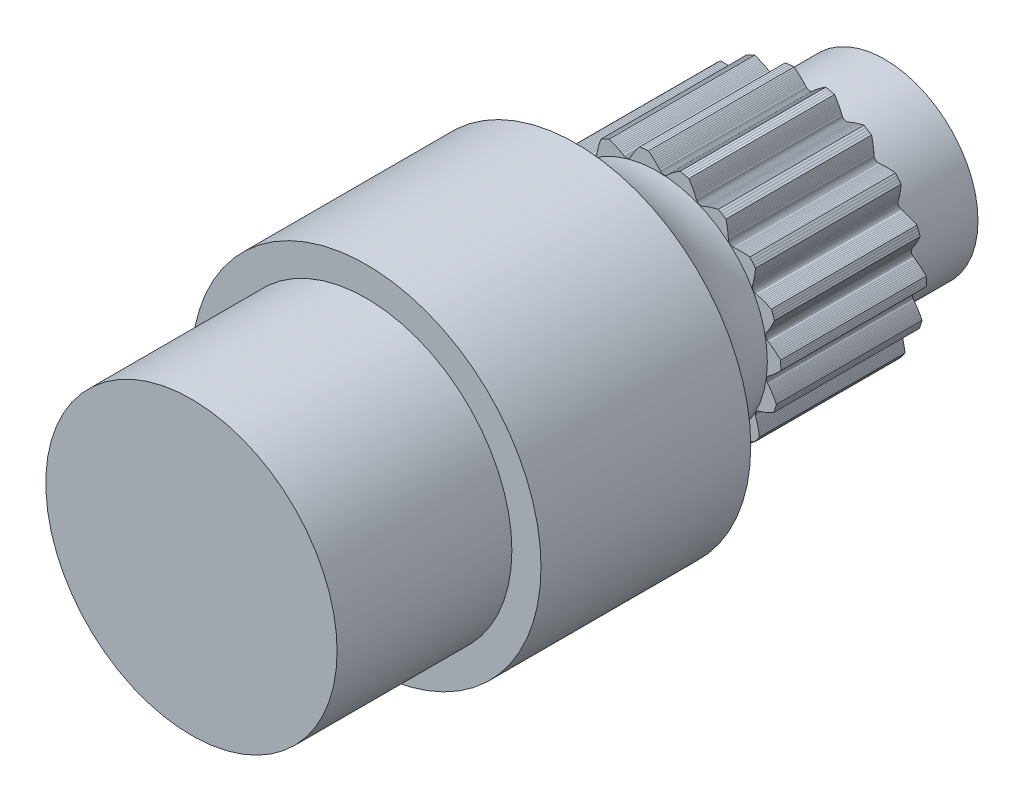
from build123d import *

# Parameters (mm, degrees)
BOSS_EXTRUDE1_DEPTH      = 6
BOSS_EXTRUDE1_DEPTH_BACK = 6.5


with BuildPart() as part:
    # 19T Shaft → Boss-Extrude1 (new, two sides: drawn at the far end of the back side and taken through both)
    with BuildSketch(Plane.XY.offset(-BOSS_EXTRUDE1_DEPTH_BACK)):
        Polygon((6.023106356, -8.692720522), (5.86435407, -8.800599502), (5.703670084, -8.90557959), (5.574457194, -8.88263519), (5.447639445, -8.857900166), (5.323239894, -8.831448754), (5.198405862, -8.802667164), (5.076149615, -8.772244747), (4.956489957, -8.740261879), (4.836752896, -8.706003916), (4.719768004, -8.670282776), (4.602985258, -8.632326454), (4.489107653, -8.593022605), (4.327362162, -8.533132654), (4.290916776, -8.521301114), (4.254021844, -8.513594141), (4.215833329, -8.509876971), (4.177758776, -8.510371404), (4.140158745, -8.515007457), (4.103409314, -8.523695892), (4.067890602, -8.536320589), (4.053138471, -8.54290106), (4.042867825, -8.547766359), (4.032591339, -8.552619311), (4.022309028, -8.557459908), (4.012020905, -8.562288143), (3.997558248, -8.569482551), (3.965220019, -8.588852651), (3.935135554, -8.611676643), (3.907636288, -8.637735147), (3.883030341, -8.666794799), (3.861601106, -8.698621956), (3.844073002, -8.731989591), (3.830012988, -8.767634612), (3.773308927, -8.930524327), (3.731178233, -9.04338666), (3.686159572, -9.157632939), (3.63928787, -9.270613062), (3.589536303, -9.384785534), (3.538078764, -9.497450788), (3.483765299, -9.611126472), (3.426545863, -9.725746938), (3.367805145, -9.838549658), (3.306201696, -9.952125968), (3.241692914, -10.066410845), (3.058468233, -10.123584954), (2.874236101, -10.177424384), (2.689057204, -10.2279114), (2.50299254, -10.275029372), (2.388230796, -10.211372806), (2.276315831, -10.146800338), (2.167245351, -10.081389669), (2.058520538, -10.013634001), (1.952766614, -9.945163416), (1.849975267, -9.87606004), (1.747849432, -9.804779708), (1.64880174, -9.733009106), (1.550671003, -9.659190066), (1.455725539, -9.585039811), (1.3221901, -9.475876187), (1.291561121, -9.452851915), (1.259167708, -9.433582762), (1.224255315, -9.417667208), (1.188083204, -9.405772064), (1.151015123, -9.397948213), (1.113435747, -9.394233364), (1.075742305, -9.394641113), (1.05965281, -9.396075027), (1.048358895, -9.397341838), (1.037063467, -9.398595073), (1.02576654, -9.399834732), (1.014468131, -9.401060812), (0.99845308, -9.403169391), (0.961577565, -9.410989759), (0.925712221, -9.422808675), (0.891241758, -9.43852626), (0.858533375, -9.458021842), (0.827930974, -9.481166455), (0.800518138, -9.507034773), (0.775646016, -9.536183169), (0.669124132, -9.671835292), (0.592629856, -9.764902619), (0.512954724, -9.858341183), (0.431938074, -9.949980515), (0.347810443, -10.0418125), (0.262558668, -10.131665005), (0.174277622, -10.221545872), (0.082941288, -10.311376766), (-0.009243679, -10.398994443), (-0.104387451, -10.486414267), (-0.202509208, -10.573560908), (-0.394370673, -10.568144209), (-0.586102234, -10.559246395), (-0.777640735, -10.546870395), (-0.968923083, -10.531020288), (-1.056797466, -10.433549734), (-1.141681923, -10.33613725), (-1.223603855, -10.238855584), (-1.304437427, -10.139468216), (-1.382228949, -10.040369314), (-1.457012949, -9.941633853), (-1.530460638, -9.841055481), (-1.600837777, -9.741012876), (-1.669682517, -9.639330557), (-1.735407025, -9.538369225), (-1.826261774, -9.391761502), (-1.847755223, -9.360039535), (-1.872136787, -9.331296313), (-1.899989758, -9.304907073), (-1.930339618, -9.281911376), (-1.962858848, -9.262475456), (-1.99719586, -9.246759884), (-2.032979363, -9.234906499), (-2.048662676, -9.23103847), (-2.059755988, -9.228569513), (-2.070846324, -9.226087225), (-2.081933669, -9.22359161), (-2.093018006, -9.22108267), (-2.108849972, -9.217876922), (-2.14626674, -9.2133001), (-2.184026396, -9.212833176), (-2.221732645, -9.216506598), (-2.258999003, -9.224325462), (-2.295458325, -9.236279452), (-2.329785287, -9.25184522), (-2.362774238, -9.271338311), (-2.507570644, -9.365052828), (-2.610139161, -9.42823986), (-2.715836727, -9.490745192), (-2.822218914, -9.551113189), (-2.931606074, -9.610653267), (-3.041413734, -9.667956109), (-3.154095739, -9.724302174), (-3.269651262, -9.779608923), (-3.385290807, -9.832546823), (-3.503664597, -9.884336868), (-3.624766315, -9.93490158), (-3.804473398, -9.867481057), (-3.982927298, -9.796810215), (-4.160069234, -9.722912332), (-4.335840855, -9.645811751), (-4.387305324, -9.525089654), (-4.435960726, -9.405393309), (-4.481856596, -9.286782624), (-4.526039357, -9.16653372), (-4.567438559, -9.047545404), (-4.606111203, -8.929877377), (-4.64292155, -8.810900194), (-4.677001681, -8.693426753), (-4.709100028, -8.574900013), (-4.73848131, -8.458068331), (-4.776809849, -8.28990373), (-4.786838617, -8.252921635), (-4.800566212, -8.21781912), (-4.81834146, -8.183815876), (-4.83958019, -8.152211566), (-4.864026605, -8.123269761), (-4.891400306, -8.097256493), (-4.921396172, -8.074426472), (-4.934973773, -8.06567566), (-4.944664349, -8.059738486), (-4.954347783, -8.053789669), (-4.96402406, -8.047829218), (-4.973693166, -8.041857141), (-4.987626407, -8.033684458), (-5.02152974, -8.017206417), (-5.057091864, -8.004504252), (-5.093947842, -7.995735439), (-5.131733787, -7.991030288), (-5.170099097, -7.990498255), (-5.207620326, -7.994074681), (-5.245151241, -8.001800087), (-5.412531233, -8.043421577), (-5.5300591, -8.069881018), (-5.650325129, -8.094679696), (-5.770544691, -8.117234549), (-5.893337586, -8.138030628), (-6.015801766, -8.156574154), (-6.140673887, -8.173279448), (-6.267926365, -8.188068707), (-6.394489147, -8.200590186), (-6.52326532, -8.211138197), (-6.654223748, -8.219641511), (-6.802302397, -8.097523223), (-6.948140388, -7.972737635), (-7.091689682, -7.845325851), (-7.232902994, -7.71532984), (-7.242380575, -7.584438313), (-7.249534353, -7.455429064), (-7.254430632, -7.328342668), (-7.257174694, -7.200263062), (-7.25769533, -7.074279562), (-7.256065838, -6.950430127), (-7.25224987, -6.825947156), (-7.246339882, -6.703772949), (-7.238213482, -6.581245998), (-7.22806762, -6.461204493), (-7.209716456, -6.289706257), (-7.207193771, -6.251471619), (-7.208779799, -6.213813712), (-7.2145511, -6.175881244), (-7.224377154, -6.139093138), (-7.238101607, -6.103781743), (-7.25554563, -6.070289718), (-7.276503343, -6.03895705), (-7.286503887, -6.02627174), (-7.293741604, -6.017509734), (-7.300968785, -6.008739034), (-7.308185419, -5.999959655), (-7.315391496, -5.991171609), (-7.32591613, -5.978917628), (-7.352632076, -5.952324018), (-7.382142959, -5.928763089), (-7.41415475, -5.908502277), (-7.448365589, -5.891782988), (-7.484479409, -5.878822587), (-7.521128898, -5.870022109), (-7.55913472, -5.865142663), (-7.730960078, -5.850160792), (-7.850711327, -5.837025351), (-7.972513129, -5.821430052), (-8.093542412, -5.803727593), (-8.216434525, -5.783526095), (-8.338284331, -5.761300828), (-8.461814736, -5.736555071), (-8.586974388, -5.709224196), (-8.710745368, -5.679972359), (-8.835969026, -5.648135294), (-8.962592786, -5.613655743), (-9.062996383, -5.450073102), (-9.160414655, -5.284695223), (-9.254815513, -5.117576581), (-9.346167863, -4.948772225), (-9.312631514, -4.821895397), (-9.277508445, -4.697553396), (-9.240874545, -4.575763073), (-9.201882546, -4.453732178), (-9.161468197, -4.334405761), (-9.119713149, -4.217795925), (-9.075684387, -4.101296827), (-9.030424718, -3.987661327), (-8.982954192, -3.874411862), (-8.934380648, -3.764168892), (-8.861338415, -3.607921517), (-8.84653765, -3.572577651), (-8.83581024, -3.536445171), (-8.828952184, -3.49869405), (-8.826300756, -3.460708711), (-8.827815989, -3.422854262), (-8.833440005, -3.385512863), (-8.843088469, -3.349072926), (-8.848428244, -3.333827771), (-8.852428782, -3.323190431), (-8.856416533, -3.31254829), (-8.86039149, -3.301901365), (-8.864353648, -3.291249669), (-8.870329167, -3.2762423), (-8.886962638, -3.242414952), (-8.90722432, -3.210548451), (-8.930922949, -3.180991214), (-8.957851405, -3.154069581), (-8.987800244, -3.130085273), (-9.019606452, -3.109861559), (-9.05396866, -3.092906025), (-9.21161944, -3.02294431), (-9.320617166, -2.971637417), (-9.430755625, -2.917338134), (-9.539479229, -2.861296698), (-9.649153292, -2.80228677), (-9.757184407, -2.741701162), (-9.86598666, -2.678185941), (-9.975490496, -2.611696655), (-10.083057167, -2.543841392), (-10.191158384, -2.473069292), (-10.299725828, -2.39934327), (-10.341574084, -2.212022994), (-10.380015856, -2.023974083), (-10.415038481, -1.835258482), (-10.446630423, -1.645938351), (-10.373714327, -1.536825295), (-10.300120542, -1.430624928), (-10.225926314, -1.327328549), (-10.149423643, -1.224570305), (-10.07245383, -1.124831841), (-9.995098034, -1.028098089), (-9.915627676, -0.93220735), (-9.835922914, -0.839424724), (-9.754252432, -0.747725082), (-9.672514902, -0.659227184), (-9.552696859, -0.535162498), (-9.527221905, -0.506539461), (-9.505343539, -0.475847922), (-9.486599303, -0.442369069), (-9.471757717, -0.407302797), (-9.460899531, -0.371007411), (-9.454094089, -0.333863157), (-9.451387746, -0.296264785), (-9.451488102, -0.280111832), (-9.451817942, -0.26875188), (-9.452134128, -0.25739154), (-9.45243666, -0.246030827), (-9.452725538, -0.23466976), (-9.453504402, -0.218535283), (-9.458252904, -0.181139915), (-9.467069715, -0.144421071), (-9.479887068, -0.108770395), (-9.496615027, -0.074563795), (-9.517153462, -0.04215465), (-9.540669693, -0.012699254), (-9.567664609, 0.014494973), (-9.694056904, 0.131855094), (-9.780489511, 0.215773542), (-9.867029415, 0.302892639), (-9.951665451, 0.391200092), (-10.036236578, 0.482623809), (-10.118742155, 0.575004368), (-10.201025843, 0.670406192), (-10.283007423, 0.768848743), (-10.362713267, 0.867954262), (-10.441977599, 0.969992141), (-10.520723759, 1.074975276), (-10.499481766, 1.265734129), (-10.474781276, 1.456076054), (-10.446630423, 1.645938351), (-10.415038481, 1.835258482), (-10.310644228, 1.914783675), (-10.206554755, 1.991333949), (-10.102840296, 2.06494262), (-9.997117203, 2.137292761), (-9.8919328, 2.206635063), (-9.787358957, 2.273010127), (-9.68105885, 2.337901259), (-9.575546242, 2.399776572), (-9.468526067, 2.459989312), (-9.362482082, 2.517152017), (-9.208872373, 2.595589682), (-9.175483838, 2.61439014), (-9.144825375, 2.636314833), (-9.116226187, 2.661893466), (-9.09080276, 2.690240695), (-9.068747808, 2.72104385), (-9.050250384, 2.753965803), (-9.035482506, 2.788648242), (-9.03033257, 2.803958569), (-9.026955968, 2.814810107), (-9.023566326, 2.825657578), (-9.020163649, 2.836500968), (-9.016747941, 2.84734026), (-9.012245748, 2.862853423), (-9.004594707, 2.899764443), (-9.00101121, 2.937356572), (-9.001558328, 2.975237384), (-9.006273055, 3.013022135), (-9.015175429, 3.050344082), (-9.027853334, 3.085839212), (-9.04455564, 3.120325216), (-9.125992882, 3.272365952), (-9.180494057, 3.379802089), (-9.234057466, 3.490300294), (-9.285434305, 3.601304281), (-9.335737903, 3.71523461), (-9.383777181, 3.829399252), (-9.430625591, 3.946349412), (-9.476200939, 4.06607745), (-9.519408591, 4.185693603), (-9.561246517, 4.307939875), (-9.601638025, 4.43280357), (-9.519607684, 4.606329319), (-9.434441612, 4.778337757), (-9.346167863, 4.948772225), (-9.254815513, 5.117576581), (-9.130255842, 5.158896122), (-9.006950389, 5.197500894), (-8.884954769, 5.233445214), (-8.761467993, 5.267546993), (-8.639467362, 5.298978818), (-8.51900767, 5.327802427), (-8.39739708, 5.35466199), (-8.277510556, 5.37892484), (-8.156737984, 5.401125694), (-8.037879054, 5.420758741), (-7.867123675, 5.445069445), (-7.829439724, 5.452010003), (-7.793323485, 5.462791969), (-7.757968512, 5.47769854), (-7.724718266, 5.496254865), (-7.693856543, 5.518227788), (-7.665671621, 5.543359835), (-7.640442538, 5.571367962), (-7.630600384, 5.584176552), (-7.623883247, 5.593343743), (-7.617155097, 5.602502853), (-7.610415943, 5.61165387), (-7.603665796, 5.620796781), (-7.594370428, 5.634007538), (-7.575148953, 5.666434328), (-7.559553475, 5.700826053), (-7.54777107, 5.736832027), (-7.53996165, 5.774100366), (-7.536263253, 5.812290703), (-7.536728985, 5.849979117), (-7.541328727, 5.888019804), (-7.568985928, 6.058265184), (-7.585649622, 6.177576637), (-7.60043211, 6.299479755), (-7.612982274, 6.421151272), (-7.623567167, 6.545242092), (-7.631934346, 6.668819308), (-7.638270724, 6.794644439), (-7.642501044, 6.922683573), (-7.644528285, 7.049848095), (-7.644406017, 7.179055479), (-7.642065826, 7.310268816), (-7.508136396, 7.447757253), (-7.371733809, 7.582792421), (-7.232902994, 7.71532984), (-7.091689682, 7.845325851), (-6.960462564, 7.843962125), (-6.831303192, 7.84043797), (-6.704246529, 7.834822815), (-6.576377777, 7.826980774), (-6.450781581, 7.817095997), (-6.327489717, 7.805244665), (-6.203747038, 7.791162008), (-6.082478161, 7.775183139), (-5.961040775, 7.7569663), (-5.842247111, 7.736942142), (-5.672850056, 7.704491445), (-5.63495433, 7.698819985), (-5.59729407, 7.697290831), (-5.559014571, 7.699909982), (-5.521540686, 7.706664537), (-5.48521654, 7.717426122), (-5.450398392, 7.732044815), (-5.417442066, 7.750343515), (-5.403974245, 7.759262358), (-5.394644479, 7.765751794), (-5.385306921, 7.772230012), (-5.375961582, 7.778697002), (-5.366608478, 7.785152756), (-5.353527234, 7.794629517), (-5.32481827, 7.819058131), (-5.298900823, 7.846522574), (-5.2760657, 7.876751904), (-5.256578407, 7.909465227), (-5.240680017, 7.944385439), (-5.228883106, 7.980183013), (-5.22088183, 8.017656085), (-5.191761904, 8.187657379), (-5.168782347, 8.305914901), (-5.143182001, 8.426012838), (-5.115545485, 8.545166888), (-5.085264636, 8.665971035), (-5.053053003, 8.785569314), (-5.018190705, 8.906634312), (-4.980617576, 9.029109514), (-4.941244722, 9.150042156), (-4.89917551, 9.272209027), (-4.854357216, 9.395553005), (-4.68304203, 9.482105125), (-4.510184263, 9.565533867), (-4.335840855, 9.645811751), (-4.160069234, 9.722912332), (-4.036395164, 9.679013121), (-3.915378295, 9.633741935), (-3.797029151, 9.587175793), (-3.678634987, 9.53823974), (-3.563053521, 9.488109529), (-3.450290071, 9.436867532), (-3.337824743, 9.383368731), (-3.228314879, 9.328879701), (-3.119372303, 9.272219245), (-3.013517041, 9.214707812), (-2.863835109, 9.129012249), (-2.829834198, 9.111343363), (-2.794710991, 9.097668796), (-2.757655144, 9.0877167), (-2.720018497, 9.081937525), (-2.682168213, 9.080321586), (-2.644489926, 9.082842765), (-2.607377687, 9.089449089), (-2.591743646, 9.09351169), (-2.580812276, 9.096620141), (-2.569877178, 9.09971545), (-2.558938368, 9.102797615), (-2.547995861, 9.10586663), (-2.532546295, 9.110582441), (-2.497460903, 9.12436566), (-2.464030046, 9.141926622), (-2.432616745, 9.163103491), (-2.403563329, 9.187716803), (-2.377187783, 9.215582742), (-2.354406608, 9.245610255), (-2.334671377, 9.278454922), (-2.251929918, 9.429789852), (-2.191797303, 9.534178406), (-2.128588318, 9.639456686), (-2.063759968, 9.743181079), (-1.995894777, 9.847607549), (-1.92659496, 9.950266563), (-1.854311857, 10.053452156), (-1.779006911, 10.157091339), (-1.702500622, 10.258687172), (-1.623043318, 10.360574854), (-1.540603679, 10.462683239), (-1.350467395, 10.488919776), (-1.15988627, 10.511701294), (-0.968923083, 10.531020288), (-0.777640735, 10.546870395), (-0.674921718, 10.46519286), (-0.575161406, 10.383080478), (-0.478344747, 10.300609514), (-0.382255016, 10.21588243), (-0.289213325, 10.13093917), (-0.199197959, 10.045859374), (-0.110197346, 9.958741853), (-0.024313587, 9.871647395), (0.06032856, 9.782683362), (0.14177436, 9.693916909), (0.255520808, 9.564262925), (0.281942378, 9.53651131), (0.310722388, 9.512173182), (0.342539007, 9.490728305), (0.376259902, 9.473041661), (0.411534659, 9.459223312), (0.447990057, 9.449373766), (0.485236523, 9.443571817), (0.501342593, 9.44233793), (0.512690983, 9.441728546), (0.524038633, 9.441105523), (0.535385525, 9.440468862), (0.546731644, 9.439818563), (0.562875331, 9.439262392), (0.600535104, 9.44090659), (0.63785662, 9.44666107), (0.67444398, 9.456490636), (0.709915131, 9.470336701), (0.743909633, 9.488128661), (0.775206379, 9.509132165), (0.804536947, 9.533789198), (0.931933616, 9.650058277), (1.022702988, 9.729265743), (1.116670938, 9.808315832), (1.211665964, 9.88537042), (1.309761252, 9.962102984), (1.40863954, 10.036698036), (1.510510452, 10.110822463), (1.615386757, 10.184394714), (1.720735837, 10.255644253), (1.828970802, 10.326211635), (1.940098172, 10.396019398), (2.128451338, 10.359097217), (2.316103398, 10.31876278), (2.50299254, 10.275029372), (2.689057204, 10.2279114), (2.759689969, 10.117306568), (2.827383145, 10.007251142), (2.892175733, 9.897812364), (2.955548218, 9.786475742), (3.015967622, 9.675924355), (3.073480342, 9.566226476), (3.129371644, 9.45493077), (3.182322459, 9.344668919), (3.233491887, 9.233041943), (3.281702309, 9.122639693), (3.347187081, 8.963077308), (3.363166122, 8.928250282), (3.382484175, 8.895886007), (3.405613742, 8.865272233), (3.431764701, 8.837594744), (3.460641364, 8.813071416), (3.491923366, 8.791918497), (3.525267826, 8.774337006), (3.540100582, 8.767940343), (3.550636219, 8.763679161), (3.561166726, 8.759405319), (3.571692089, 8.755118823), (3.582212292, 8.75081968), (3.597300682, 8.745051798), (3.633453814, 8.734378801), (3.670621624, 8.72770321), (3.708418235, 8.725120287), (3.746463271, 8.72669867), (3.784392897, 8.732488617), (3.820813726, 8.742192056), (3.856561208, 8.755989483), (4.014807682, 8.824593151), (4.126377542, 8.870036171), (4.240921571, 8.914291765), (4.355789088, 8.956326488), (4.473484325, 8.997049982), (4.59122609, 9.035497541), (4.711645517, 9.072528271), (4.834728205, 9.108060894), (4.957503868, 9.141243146), (5.082787556, 9.172843157), (5.210560282, 9.202785546), (5.376719341, 9.106705737), (5.541107325, 9.007626206), (5.703670084, 8.90557959), (5.86435407, 8.800599502), (5.895246427, 8.673053124), (5.923536862, 8.546980865), (5.949284095, 8.422433664), (5.973071942, 8.296552554), (5.994321679, 8.172372999), (6.013099358, 8.049944503), (6.029824659, 7.926531229), (6.044104489, 7.805050568), (6.056256195, 7.682857163), (6.066006892, 7.562782913), (6.076133696, 7.390603188), (6.079938632, 7.3524748), (6.087701317, 7.315591549), (6.099637384, 7.279126356), (6.115384546, 7.244457307), (6.13473388, 7.211886484), (6.157452596, 7.181722439), (6.18328166, 7.154266633), (6.195233743, 7.14340037), (6.203814926, 7.135949155), (6.212387148, 7.128487632), (6.220950395, 7.121015811), (6.229504655, 7.113533703), (6.241902685, 7.103179148), (6.272631425, 7.081345541), (6.30561782, 7.062963284), (6.340527832, 7.048247771), (6.377023983, 7.03738743), (6.41477847, 7.030547932), (6.452376619, 7.027899788), (6.490667222, 7.029342444), (6.66261504, 7.04284643), (6.782895061, 7.049600548), (6.905602547, 7.054265866), (7.027894878, 7.05672561), (7.152435959, 7.057027012), (7.276282052, 7.055160687), (7.402200681, 7.051084867), (7.530151833, 7.04472735), (7.657049432, 7.036246504), (7.78580541, 7.025454792), (7.916377336, 7.012287083), (8.042336376, 6.867461385), (8.165646294, 6.720373565), (8.286266472, 6.571072075), (8.404157178, 6.419606092), (8.391961461, 6.288939797), (8.377783446, 6.160512592), (8.361695213, 6.034353588), (8.343320639, 5.907569164), (8.323097971, 5.78321822), (8.301105757, 5.661326136), (8.27685261, 5.539169037), (8.250914012, 5.41963388), (8.222731173, 5.300115599), (8.192965505, 5.183381257), (8.146636945, 5.017242536), (8.137855452, 4.979944588), (8.133221561, 4.942539234), (8.13267067, 4.904174191), (8.136307586, 4.866270512), (8.14403279, 4.829181747), (8.155726294, 4.793275318), (8.171240983, 4.75892046), (8.179017199, 4.744762127), (8.184714025, 4.734928333), (8.190399027, 4.7250877), (8.196072197, 4.715240241), (8.201733527, 4.705385971), (8.21009768, 4.69156682), (8.232072091, 4.660938613), (8.257302483, 4.632841692), (8.285542855, 4.607588244), (8.316535197, 4.585466065), (8.35002326, 4.566738288), (8.384724387, 4.552025529), (8.421408729, 4.54095708), (8.588424678, 4.497898017), (8.704380654, 4.465231319), (8.821954335, 4.429800802), (8.938419208, 4.392419016), (9.056310175, 4.352265663), (9.17283995, 4.310287701), (9.290612544, 4.265547008), (9.409566667, 4.217988288), (9.526834878, 4.168763374), (9.64511044, 4.116749389), (9.764332069, 4.061898508), (9.836441474, 3.884021032), (9.905310784, 3.704864172), (9.970917313, 3.52448694), (10.033239452, 3.342948752), (9.979277255, 3.22332226), (9.924167199, 3.106457189), (9.867986909, 2.992357669), (9.809441085, 2.878408988), (9.749937452, 2.767362012), (9.689558541, 2.659215237), (9.626955152, 2.551551931), (9.563608977, 2.446915767), (9.498145639, 2.343024269), (9.432089178, 2.242279812), (9.334325673, 2.100185804), (9.313909361, 2.067760109), (9.297381049, 2.033886102), (9.284402897, 1.997778657), (9.275535451, 1.960747798), (9.27079938, 1.923160235), (9.270200499, 1.885402442), (9.273719555, 1.847871413), (9.276477231, 1.831955284), (9.278672359, 1.820804556), (9.280854084, 1.809651199), (9.283022401, 1.798495227), (9.285177309, 1.787336657), (9.288601198, 1.771550431), (9.299440012, 1.735446664), (9.314180296, 1.700679817), (9.332690746, 1.667625037), (9.354820778, 1.636638302), (9.380413466, 1.608051691), (9.408457165, 1.582868672), (9.439559929, 1.560488556), (9.583545238, 1.465532562), (9.68261154, 1.396984992), (9.782310485, 1.325298086), (9.880327124, 1.252125665), (9.978792661, 1.175868798), (10.075378309, 1.098328162), (10.172242379, 1.017770944), (10.269308949, 0.934164746), (10.364239941, 0.849530047), (10.459218093, 0.761930312), (10.554169914, 0.671340203), (10.564615511, 0.479686734), (10.571581154, 0.287875258), (10.575064549, 0.095968957), (10.575064549, -0.095968957), (10.485183515, -0.191592259), (10.395113447, -0.284231052), (10.304929106, -0.373906635), (10.212556381, -0.462671464), (10.120219924, -0.548380811), (10.027997308, -0.631062895), (9.933827725, -0.712565418), (9.839938514, -0.790963637), (9.744288646, -0.867970096), (9.649099635, -0.941807442), (9.510495377, -1.044458647), (9.480656671, -1.068498263), (9.454025036, -1.095170149), (9.430026009, -1.125107194), (9.409615125, -1.157252363), (9.392931006, -1.191265529), (9.380104638, -1.226783045), (9.371246717, -1.263423174), (9.368687016, -1.27937234), (9.367142571, -1.290631647), (9.365584594, -1.30188909), (9.364013088, -1.313144652), (9.362428055, -1.324398317), (9.360540649, -1.340440937), (9.359069312, -1.378107859), (9.361722151, -1.415777105), (9.368496783, -1.453051219), (9.379366373, -1.489544617), (9.394290321, -1.524892259), (9.412637622, -1.557816566), (9.43478834, -1.589083117), (9.540139968, -1.725646086), (9.611581224, -1.822646336), (9.682601505, -1.922821242), (9.751548286, -2.02385493), (9.819918124, -2.127951697), (9.886093092, -2.232652277), (9.951551914, -2.340296395), (10.016212261, -2.450890042), (10.078518789, -2.561763041), (10.139907175, -2.675455737), (10.200299684, -2.79196823), (10.14794953, -2.976629065), (10.092256671, -3.160309407), (10.033239452, -3.342948752), (9.970917313, -3.52448694), (9.854857446, -3.585744783), (9.739587856, -3.644118448), (9.625172338, -3.699652353), (9.508982728, -3.753614284), (9.393819536, -3.804698063), (9.279746967, -3.852955569), (9.164215926, -3.899465248), (9.049958031, -3.943129858), (8.93448678, -3.984906433), (8.820480425, -4.023835247), (8.656055336, -4.075919797), (8.620027724, -4.088968269), (8.586178717, -4.10554772), (8.55375948, -4.126070223), (8.524016994, -4.149846274), (8.49719281, -4.176599188), (8.473528892, -4.206027552), (8.453253887, -4.237806256), (8.445654192, -4.252060119), (8.440537538, -4.262207885), (8.435408691, -4.272349494), (8.430267659, -4.282484932), (8.425114448, -4.292614183), (8.418120277, -4.30717473), (8.404498231, -4.342323012), (8.394776148, -4.378812609), (8.389080827, -4.416266829), (8.387512085, -4.454312264), (8.390150052, -4.492590471), (8.396812741, -4.529688207), (8.407611039, -4.566452977), (8.462912501, -4.729824205), (8.498986944, -4.844765652), (8.533632411, -4.962573053), (8.566037881, -5.08051944), (8.596903088, -5.201175607), (8.625496291, -5.321690198), (8.652456385, -5.444756305), (8.677703558, -5.570352864), (8.700633742, -5.695449355), (8.721779978, -5.822914643), (8.74106871, -5.952723584), (8.631595756, -6.110380918), (8.51927958, -6.26602551), (8.404157178, -6.419606092), (8.286266472, -6.571072075), (8.156604659, -6.591326222), (8.028626795, -6.609109066), (7.902378796, -6.624483333), (7.77496325, -6.637794752), (7.649453041, -6.648717245), (7.525892052, -6.657320724), (7.401519133, -6.663797512), (7.27927417, -6.667996775), (7.156494638, -6.670016326), (7.036025297, -6.669818066), (6.863597387, -6.665691793), (6.825285018, -6.666335116), (6.787886705, -6.671025492), (6.750560386, -6.67990952), (6.714709359, -6.69273995), (6.680651926, -6.709333519), (6.648714811, -6.729483712), (6.619219833, -6.752957274), (6.607403689, -6.763971206), (6.599269295, -6.771907764), (6.591125368, -6.779834539), (6.58297192, -6.78775152), (6.574808962, -6.795658695), (6.563465952, -6.807159308), (6.539169358, -6.835980088), (6.518125891, -6.867335823), (6.500577793, -6.900911402), (6.486740717, -6.936386061), (6.476806838, -6.973446796), (6.471062909, -7.010697846), (6.469338625, -7.0489768), (6.46859715, -7.221452481), (6.465395553, -7.341879435), (6.459911833, -7.464553071), (6.452264355, -7.586630836), (6.442280207, -7.710771436), (6.430193128, -7.834040411), (6.41573295, -7.959192385), (6.398831025, -8.08618152), (6.379900024, -8.211945357), (6.358512587, -8.339370396), (6.334607308, -8.468408971), (6.179874649, -8.581978186), align=None)
    extrude(amount=BOSS_EXTRUDE1_DEPTH + BOSS_EXTRUDE1_DEPTH_BACK)

    # Sketch3 → Revolve2 (revolve)
    with BuildSketch(Plane(origin=(0, 0, 0), x_dir=(0, 0, -1), z_dir=(1, 0, 0))):
        with BuildLine():
            ThreePointArc((-6, 9.422433664), (-10.352994849, 11.140684707), (-13, 15))
            Line((-13, 15), (-31, 15))
            Line((-31, 15), (-31, 12.5))
            Line((-31, 12.5), (-46, 12.5))
            Line((-46, 12.5), (-46, 0))
            Line((-46, 0), (13.5, 0))
            Line((13.5, 0), (13.5, 8))
            Line((13.5, 8), (6.5, 8))
            Line((6.5, 8), (-6, 8.422433664))
            Line((-6, 8.422433664), (-6, 9.422433664))
        make_face()
    revolve(axis=Axis((0, 0, -6.5), (0, 0, -1)))


solid = part.part
